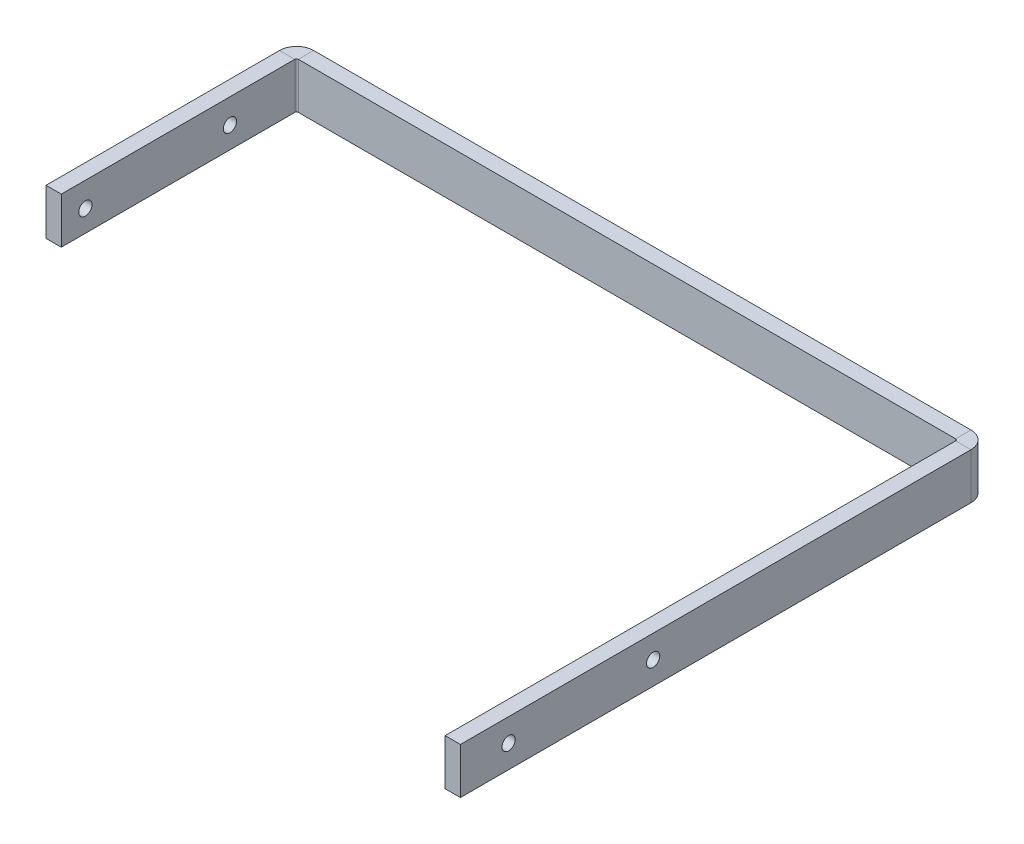
from build123d import *

# Parameters (mm, degrees)
CROQUIS1_W                       = 594
CROQUIS1_H                       = 19.095477387
BRIDA_BASE1_DEPTH                = 6.35
PLIEGUE_CROQUIZADO1_DEPTH        = 19.095477387
PLIEGUE_CROQUIZADO1_2_DEPTH      = 19.095477387
TALADRO_DE_MARGEN_PARA_M51_D     = 5.5
TALADRO_DE_MARGEN_PARA_M52_D     = 5.5
TALADRO_DE_MARGEN_PARA_M52_DEPTH = 6.35


with BuildPart() as part:
    # Brida base1: sheet metal written as solids
    # Croquis1 → Brida base1 (new body)
    with BuildSketch(Plane.XY):
        with Locations((58.84427983, 9.547738694)):
            Rectangle(CROQUIS1_W, CROQUIS1_H)
    extrude(amount=-BRIDA_BASE1_DEPTH)

    # Pliegue croquizado1: read off the stored shape, not the designer's step
    # Pliegue croquizado1 outline → Pliegue croquizado1 (cut)
    with BuildSketch(Plane(origin=(0, 0, 0), x_dir=(1, 0, 0), z_dir=(0, 1, 0))):
        with BuildLine():
            ThreePointArc((-142.131770672, 0), (-139.826968461, 4.528373368), (-135.083556714, 6.35))
            Line((-135.083556714, 6.35), (-238.15572017, 6.35))
            Line((-238.15572017, 6.35), (-238.15572017, 0))
            Line((-238.15572017, 0), (-142.131770672, 0))
        make_face()
        with BuildLine():
            Line((355.84427983, 6.35), (137.772116374, 6.35))
            ThreePointArc((137.772116374, 6.35), (142.515528121, 4.528373367), (144.820330332, 0))
            Line((144.820330332, 0), (355.84427983, 0))
            Line((355.84427983, 0), (355.84427983, 6.35))
        make_face()
    extrude(amount=PLIEGUE_CROQUIZADO1_DEPTH, mode=Mode.SUBTRACT)

    # Pliegue croquizado1 2 outline → Pliegue croquizado1 2 (add)
    with BuildSketch(Plane(origin=(0, 0, 0), x_dir=(1, 0, 0), z_dir=(0, 1, 0))):
        with BuildLine():
            Line((-135.083556714, 0), (-142.131770672, 0))
            ThreePointArc((-142.131770672, 0), (-142.160553697, -0.367800241), (-142.170156714, -0.7366))
            Line((-142.170156714, -0.7366), (-142.170156714, -97.664436544))
            Line((-142.170156714, -97.664436544), (-135.820156714, -97.664436544))
            Line((-135.820156714, -97.664436544), (-135.820156714, -0.7366))
            ThreePointArc((-135.820156714, -0.7366), (-135.604411569, -0.215745145), (-135.083556714, 0))
        make_face()
        with BuildLine():
            ThreePointArc((144.858716374, -0.7366), (144.849113357, -0.367800241), (144.820330332, 0))
            Line((144.820330332, 0), (137.772116374, 0))
            ThreePointArc((137.772116374, 0), (138.292971229, -0.215745145), (138.508716374, -0.7366))
            Line((138.508716374, -0.7366), (138.508716374, -212.664436544))
            Line((138.508716374, -212.664436544), (144.858716374, -212.664436544))
            Line((144.858716374, -212.664436544), (144.858716374, -0.7366))
        make_face()
    extrude(amount=PLIEGUE_CROQUIZADO1_2_DEPTH)

    # Taladro de margen para M51 (through all)
    with Locations(Plane(origin=(144.858716374, 0, 0), x_dir=(0, 0, -1), z_dir=(1, 0, 0))):
        with Locations((-192.664436544, 9.547738693), (-132.664436544, 9.547738693)):
            Hole(TALADRO_DE_MARGEN_PARA_M51_D / 2)

    # Taladro de margen para M52
    with Locations(Plane(origin=(-135.820156714, 0, 0), x_dir=(0, 0, -1), z_dir=(1, 0, 0))):
        with Locations((-87.664436544, 8.935987286), (-27.664436544, 8.935987286)):
            Hole(TALADRO_DE_MARGEN_PARA_M52_D / 2, depth=TALADRO_DE_MARGEN_PARA_M52_DEPTH)


solid = part.part
